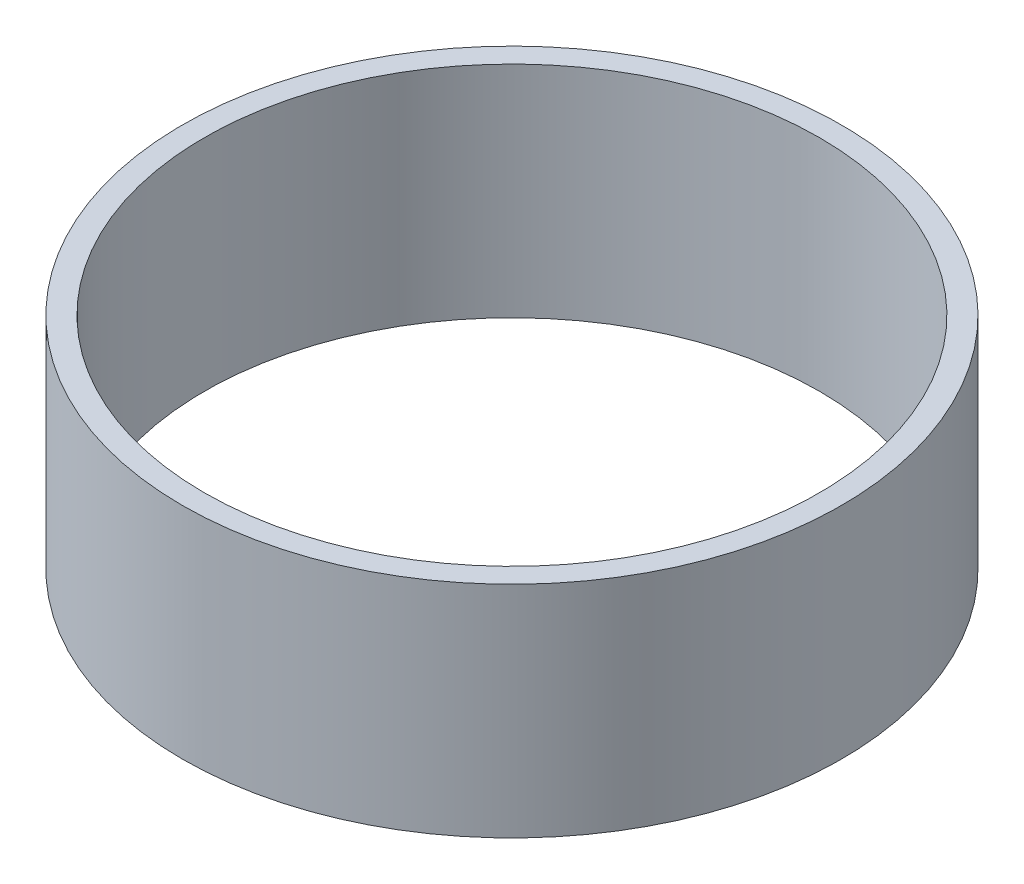
from build123d import *

# Parameters (mm, degrees)
BOSS_EXTRUDE1_OUTLINE_R   = 15
BOSS_EXTRUDE1_OUTLINE_R_2 = 14
BOSS_EXTRUDE1_DEPTH       = 10


# Read off the part's stored shape, not the designer's step: Boss-Extrude1
with BuildPart() as part:
    # Boss-Extrude1 outline → Boss-Extrude1 (new body)
    with BuildSketch(Plane(origin=(0, 150, 0), x_dir=(1, 0, 0), z_dir=(0, 1, 0))):
        Circle(BOSS_EXTRUDE1_OUTLINE_R)
        Circle(BOSS_EXTRUDE1_OUTLINE_R_2, mode=Mode.SUBTRACT)
    extrude(amount=BOSS_EXTRUDE1_DEPTH)


solid = part.part
